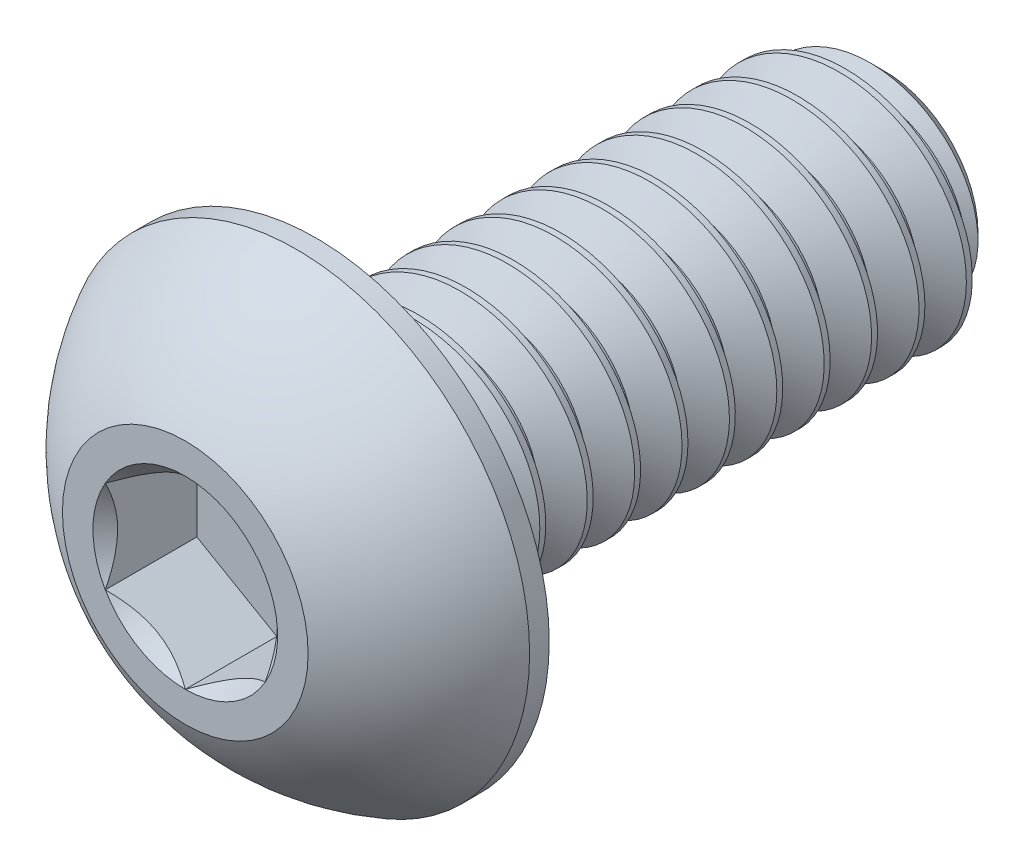
from build123d import *

# Parameters (mm, degrees)
SKETCH11_W         = 12.7
SKETCH11_H         = 2.7432
CHAMFER1_SIZE      = 0.661458333
CUT_EXTRUDE2_DEPTH = 2.0447
SKETCH6_R          = 2.062222993
CUT_EXTRUDE3_DEPTH = 2.0447
CUT_EXTRUDE3_TAPER = 45
CUT_SWEEP1_PITCH   = 1.058333333


with BuildPart() as part:
    # Sketch11 → Revolve1 (revolve)
    with BuildSketch(Plane(origin=(0, 0, 0), x_dir=(0, 0, -1), z_dir=(1, 0, 0)), mode=Mode.PRIVATE) as revolve1_sk:
        with Locations((9.271, 1.3716)):
            Rectangle(SKETCH11_W, SKETCH11_H)
    revolve(revolve1_sk.sketch.rotate(Axis((0, 0, -2.921), (0, 0, -1)), 180), axis=Axis((0, 0, -2.921), (0, 0, -1)))

    # Chamfer1
    chamfer1_edges = [part.edges().sort_by_distance(p)[0] for p in [
        (0, 2.7432, -15.621),
    ]]
    chamfer(chamfer1_edges, length=CHAMFER1_SIZE)


with BuildPart() as body_2:
    # Sketch7 → Revolve2 (revolve)
    with BuildSketch(Plane(origin=(0, 0, 0), x_dir=(0, 0, -1), z_dir=(1, 0, 0)), mode=Mode.PRIVATE) as revolve2_sk:
        with BuildLine():
            Line((2.48285, 5.207), (2.921, 5.207))
            Line((2.921, 5.207), (2.921, 0))
            Line((2.921, 0), (0, 0))
            Line((0, 0), (0, 2.7432))
            ThreePointArc((0, 2.7432), (1.053538269, 4.164439463), (2.48285, 5.207))
        make_face()
    revolve(revolve2_sk.sketch.rotate(Axis((0, 0, 0), (0, 0, -1)), 180), axis=Axis((0, 0, 0), (0, 0, -1)))

    # Sketch5 → Cut-Extrude2 (cut)
    with BuildSketch(Plane.XY):
        Polygon((1.7859375, -1.031111496), (1.7859375, 1.031111496), (0, 2.062222993), (-1.7859375, 1.031111496), (-1.7859375, -1.031111496), (0, -2.062222993), align=None)
    extrude(amount=-CUT_EXTRUDE2_DEPTH, mode=Mode.SUBTRACT)

    # Sketch6 → Cut-Extrude3 (cut)
    with BuildSketch(Plane.XY):
        Circle(SKETCH6_R)
    extrude(amount=-CUT_EXTRUDE3_DEPTH, taper=CUT_EXTRUDE3_TAPER, mode=Mode.SUBTRACT)


with BuildPart() as cut_sweep1_tool:
    # Cut-Sweep1: the profile of Sketch2 screwed along a right-hand helix of 13 turns, 8 arcs to a turn; built about Z, then put on its axis
    cut_sweep1_z = Axis((0, 0, 0), (0, 0, 1))
    cut_sweep1_corners = [(2.800483972, 0, 0.033072917), (2.800483972, 0, -0.959114583), (2.055792336, 0, -0.529166667), (2.055792336, 0, -0.396875)]
    with BuildLine(mode=Mode.PRIVATE) as cut_sweep1_profile:
        Line(cut_sweep1_corners[0], cut_sweep1_corners[1])
        Line(cut_sweep1_corners[1], cut_sweep1_corners[2])
        Line(cut_sweep1_corners[2], cut_sweep1_corners[3])
        Line(cut_sweep1_corners[3], cut_sweep1_corners[0])
    cut_sweep1_cap = Face(cut_sweep1_profile.wire())
    cut_sweep1_turn_angles = [0, 22.5, 45, 67.5, 90, 112.5, 135, 157.5, 180, 202.5, 225, 247.5, 270, 292.5, 315, 337.5, 360]
    cut_sweep1_turn_weights = [1, 0.9238795325112867, 1, 0.9238795325112867, 1, 0.9238795325112867, 1, 0.9238795325112867, 1, 0.9238795325112867, 1, 0.9238795325112867, 1, 0.9238795325112867, 1, 0.9238795325112867, 1]
    cut_sweep1_turn_rails = [Edge.make_bspline([Vector(p[0], p[1], 0).rotate(cut_sweep1_z, cut_sweep1_turn_angles[k]) / cut_sweep1_turn_weights[k] + Vector(0, 0, p[2] + CUT_SWEEP1_PITCH * cut_sweep1_turn_angles[k] / 360) for k in range(17)], [0, 0, 0, 1, 1, 2, 2, 3, 3, 4, 4, 5, 5, 6, 6, 7, 7, 8, 8, 8], 2, cut_sweep1_turn_weights) for p in cut_sweep1_corners]
    cut_sweep1_turn_sides = [Face.make_surface_from_curves(cut_sweep1_turn_rails[p[0]], cut_sweep1_turn_rails[p[1]]) for p in [(0, 1), (1, 2), (2, 3), (3, 0)]]
    cut_sweep1 = Plane(origin=(0, 0, -15.621), x_dir=(0, 1, 0), z_dir=(0, 0, 1)) * Solid(Shell([*[p.moved(Location((0, 0, CUT_SWEEP1_PITCH * i))) for i in range(13) for p in cut_sweep1_turn_sides], cut_sweep1_cap, cut_sweep1_cap.rotate(cut_sweep1_z, 4680).moved(Location((0, 0, CUT_SWEEP1_PITCH * 4680 / 360)))]))
    add(cut_sweep1)


with BuildPart() as part_1:
    add(part.part)

    # Cut-Sweep1: cut by cut_sweep1_tool
    add(cut_sweep1_tool.part, mode=Mode.SUBTRACT)


with BuildPart() as body_2_1:
    add(body_2.part)

    # Cut-Sweep1: cut by cut_sweep1_tool
    add(cut_sweep1_tool.part, mode=Mode.SUBTRACT)


solid = Compound([part_1.part, body_2_1.part])
